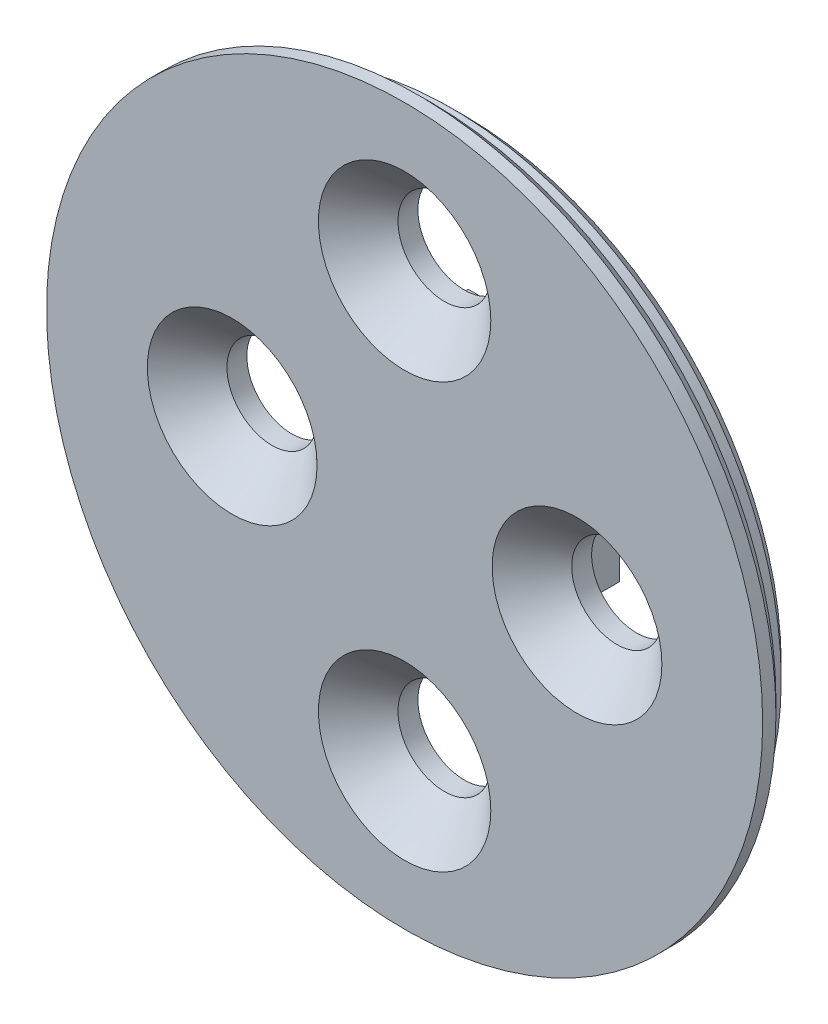
from build123d import *

# Parameters (mm, degrees)
SKETCH1_R           = 12.45
SKETCH1_R_2         = 1.7
BOSS_EXTRUDE1_DEPTH = 1.25
SKETCH2_W           = 5.7
SKETCH2_H           = 6.7
BOSS_EXTRUDE2_DEPTH = 3.5
BOSS_EXTRUDE3_START = 1
SKETCH3_R           = 13.5
SKETCH3_R_2         = 1.7
BOSS_EXTRUDE3_DEPTH = 1
CHAMFER1_SIZE       = 0.5
SKETCH5_R           = 1.75
CUT_EXTRUDE2_DEPTH  = 20.938969382
CHAMFER3_SIZE       = 1.5
CHAMFER2_SIZE       = 0.5


with BuildPart() as part:
    # Sketch1 → Boss-Extrude1 (new body)
    with BuildSketch(Plane.XY):
        Circle(SKETCH1_R)
        with Locations((-6.5, 0)):
            Circle(SKETCH1_R_2, mode=Mode.SUBTRACT)
        with Locations((6.5, 0)):
            Circle(SKETCH1_R_2, mode=Mode.SUBTRACT)
    extrude(amount=-BOSS_EXTRUDE1_DEPTH)

    # Sketch2 → Boss-Extrude2 (add)
    with BuildSketch(Plane(origin=(0, 0, -1.25), x_dir=(-1, 0, 0), z_dir=(0, 0, -1))):
        Rectangle(SKETCH2_W, SKETCH2_H)
    extrude(amount=BOSS_EXTRUDE2_DEPTH)

    # Sketch3 → Boss-Extrude3 (add)
    with BuildSketch(Plane.XY.offset(BOSS_EXTRUDE3_START)):
        Circle(SKETCH3_R)
        with Locations((-6.5, 0)):
            Circle(SKETCH3_R_2, mode=Mode.SUBTRACT)
        with Locations((6.5, 0)):
            Circle(SKETCH3_R_2, mode=Mode.SUBTRACT)
    extrude(amount=-BOSS_EXTRUDE3_DEPTH)

    # Chamfer1
    chamfer1_edges = [part.edges().sort_by_distance(p)[0] for p in [
        (0, 3.35, -4.75),
        (2.85, 0, -4.75),
        (0, -3.35, -4.75),
        (-2.85, 0, -4.75),
        (-12.45, 0, -1.25),
    ]]
    chamfer(chamfer1_edges, length=CHAMFER1_SIZE)

    # Sketch5 → Cut-Extrude2 (cut, through all)
    with BuildSketch(Plane.XY.offset(1)):
        with Locations((0, 8)):
            Circle(SKETCH5_R)
        with Locations((0, -8)):
            Circle(SKETCH5_R)
    extrude(amount=-CUT_EXTRUDE2_DEPTH, mode=Mode.SUBTRACT)

    # Chamfer3
    chamfer3_edges = [part.edges().sort_by_distance(p)[0] for p in [
        (4.8, 0, 1),
        (-8.2, 0, 1),
        (-1.75, 8, 1),
        (-1.75, -8, 1),
    ]]
    chamfer(chamfer3_edges, length=CHAMFER3_SIZE)

    # Chamfer2
    chamfer2_edges = [part.edges().sort_by_distance(p)[0] for p in [
        (-13.5, 0, 0),
    ]]
    chamfer(chamfer2_edges, length=CHAMFER2_SIZE)


solid = part.part
